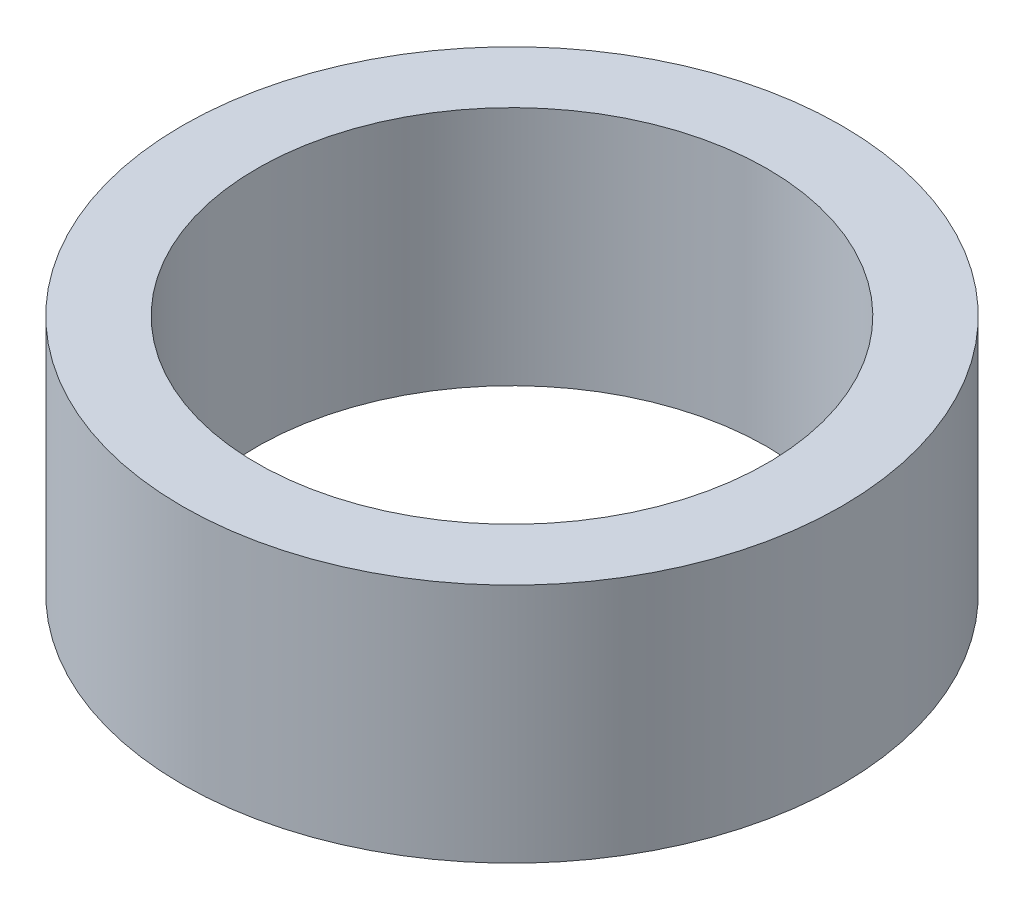
from build123d import *

# Parameters (mm, degrees)
SKETCH1_R           = 57.5
SKETCH1_R_2         = 44.5
BOSS_EXTRUDE1_DEPTH = 42


with BuildPart() as part:
    # Sketch1 → Boss-Extrude1 (new body)
    with BuildSketch(Plane(origin=(0, 0, 0), x_dir=(1, 0, 0), z_dir=(0, 1, 0))):
        Circle(SKETCH1_R)
        Circle(SKETCH1_R_2, mode=Mode.SUBTRACT)
    extrude(amount=BOSS_EXTRUDE1_DEPTH)


solid = part.part
